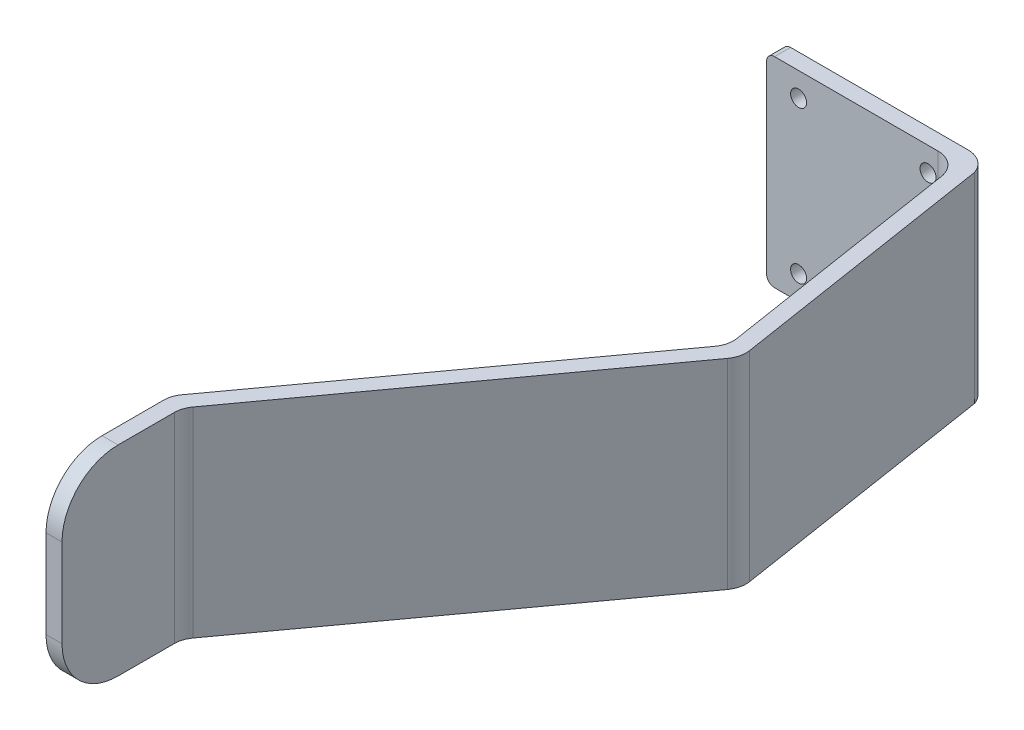
from build123d import *

# Parameters (mm, degrees)
SKETCH1_W           = 2
SKETCH1_H           = 15
SKETCH1_W_2         = 26
SKETCH1_H_2         = 2
BOSS_EXTRUDE1_DEPTH = 25
SKETCH2_R           = 2.5
BOSS_EXTRUDE2_DEPTH = 2
SKETCH3_R           = 2.5
BOSS_EXTRUDE3_DEPTH = 2
FILLET1_R           = 2.5
FILLET2_R           = 7
FILLET3_R           = 1
FILLET4_R           = 3
FILLET5_R           = 3
FILLET6_R           = 3
CUT_EXTRUDE2_REACH  = 99.071
SKETCH8_R           = 1


with BuildPart() as part:
    # Sketch1 → Boss-Extrude1 (new body)
    with BuildSketch(Plane(origin=(0, 0, 0), x_dir=(1, 0, 0), z_dir=(0, 1, 0))):
        Polygon((-12.616932988, -74.822915589), (-13, -75.349125674), (-13, -76), (-11, -76), (18.427110278, -35.576675289), (13, -1), (10.975513857, -1), (11.024189983, -1.310120587), (16.322926791, -35.068915352), align=None)
        with Locations((-12, -83.5)):
            Rectangle(SKETCH1_W, SKETCH1_H)
        Rectangle(SKETCH1_W_2, SKETCH1_H_2)
    extrude(amount=BOSS_EXTRUDE1_DEPTH)

    # Sketch2 → Boss-Extrude2 (add)
    with BuildSketch(Plane(origin=(10.558437112, 0, -1.657238647), x_dir=(0.15506029365043303, 0, 0.9879050082538512), z_dir=(-0.9879050082538512, 0, 0.15506029365043303))):
        with Locations((28.554289051, 18.75)):
            Circle(SKETCH2_R)
        with BuildLine():
            ThreePointArc((11.31127729, 16.25), (13.079044243, 16.982233047), (13.81127729, 18.75))
            Line((13.81127729, 18.75), (11.31127729, 18.75))
            Line((11.31127729, 18.75), (11.31127729, 16.25))
        make_face()
        with BuildLine():
            Line((11.31127729, 18.75), (13.81127729, 18.75))
            ThreePointArc((13.81127729, 18.75), (9.543510337, 20.517766953), (11.31127729, 16.25))
            Line((11.31127729, 16.25), (11.31127729, 18.75))
        make_face()
        with Locations((11.31127729, 6.25)):
            Circle(SKETCH2_R)
        with Locations((28.554289051, 6.25)):
            Circle(SKETCH2_R)
    extrude(amount=BOSS_EXTRUDE2_DEPTH)

    # Sketch3 → Boss-Extrude3 (add)
    with BuildSketch(Plane(origin=(27.355333892, 0, 19.913958906), x_dir=(-0.5885422055553007, 0, 0.8084664942223037), z_dir=(-0.8084664942223037, 0, -0.5885422055553007))):
        with BuildLine():
            ThreePointArc((33.701056824, 18.75), (29.433289871, 20.517766953), (31.201056824, 16.25))
            Line((31.201056824, 16.25), (31.201056824, 18.75))
            Line((31.201056824, 18.75), (33.701056824, 18.75))
        make_face()
        with BuildLine():
            Line((31.201056824, 18.75), (31.201056824, 16.25))
            ThreePointArc((31.201056824, 16.25), (32.968823777, 16.982233047), (33.701056824, 18.75))
            Line((33.701056824, 18.75), (31.201056824, 18.75))
        make_face()
        with Locations((31.201056824, 6.25)):
            Circle(SKETCH3_R)
        with Locations((56.11254704, 6.25)):
            Circle(SKETCH3_R)
        with Locations((56.11254704, 18.75)):
            Circle(SKETCH3_R)
    extrude(amount=BOSS_EXTRUDE3_DEPTH)

    # Fillet1
    # the kernel refuses this fillet: 2.5 mm, written as the material it takes off along each edge
    with BuildSketch(Plane(origin=(13.010263541, 18.75, 26.861807101), x_dir=(0.1550602936504321, 0, 0.9879050082538512), z_dir=(0, -1, 0))) as fillet1_piece_1:
        with BuildLine():
            CenterArc((0.050510257, -2.5), FILLET1_R, 11.536959033, 78.463040967)
            Line((0.050510257, 0), (0.050510257, 0.05))
            Line((0.050510257, 0.05), (2.5, 0.05))
            Line((2.5, 0.05), (2.55, 0))
            ThreePointArc((2.55, 0), (2.55, -1), (2.548989795, -1.99))
            Line((2.548989795, -1.99), (2.5, -2))
        make_face()
    revolve(axis=Axis((13.010263541, 18.75, 26.861807101), (-0.9879050082538512, 0, 0.15506029365043303)), mode=Mode.SUBTRACT)
    with BuildSketch(Plane(origin=(10.336557074, 18.75, 9.827349425), x_dir=(0, -1, 0), z_dir=(0.1550602936504327, 1.65855285874559e-14, 0.9879050082538511))) as fillet1_piece_2:
        with BuildLine():
            CenterArc((0.050510257, 2.5), FILLET1_R, 270, 78.463040967)
            Line((0.050510257, 0), (0.050510257, -0.05))
            Line((0.050510257, -0.05), (2.5, -0.05))
            Line((2.5, -0.05), (2.55, 0))
            ThreePointArc((2.55, 0), (2.55, 1), (2.548989795, 1.99))
            Line((2.548989795, 1.99), (2.5, 2))
        make_face()
    revolve(axis=Axis((10.336557074, 18.75, 9.827349425), (0.9879050082538511, 0, -0.1550602936504327)), mode=Mode.SUBTRACT)
    with BuildSketch(Plane(origin=(10.336557074, 6.25, 9.827349425), x_dir=(0.1550602936504327, 0, 0.9879050082538511), z_dir=(0, -1, 0))) as fillet1_piece_3:
        with BuildLine():
            CenterArc((0.050510257, -2.5), FILLET1_R, 11.536959033, 78.463040967)
            Line((0.050510257, 0), (0.050510257, 0.05))
            Line((0.050510257, 0.05), (2.5, 0.05))
            Line((2.5, 0.05), (2.55, 0))
            ThreePointArc((2.55, 0), (2.55, -1), (2.548989795, -1.99))
            Line((2.548989795, -1.99), (2.5, -2))
        make_face()
    revolve(axis=Axis((10.336557074, 6.25, 9.827349425), (-0.9879050082538512, 0, 0.15506029365043303)), mode=Mode.SUBTRACT)
    with BuildSketch(Plane(origin=(13.010263541, 6.25, 26.861807101), x_dir=(0.1550602936504321, 0, 0.9879050082538512), z_dir=(0, -1, 0))) as fillet1_piece_4:
        with BuildLine():
            CenterArc((0.050510257, -2.5), FILLET1_R, 11.536959033, 78.463040967)
            Line((0.050510257, 0), (0.050510257, 0.05))
            Line((0.050510257, 0.05), (2.5, 0.05))
            Line((2.5, 0.05), (2.55, 0))
            ThreePointArc((2.55, 0), (2.55, -1), (2.548989795, -1.99))
            Line((2.548989795, -1.99), (2.5, -2))
        make_face()
    revolve(axis=Axis((13.010263541, 6.25, 26.861807101), (-0.9879050082538512, 0, 0.15506029365043303)), mode=Mode.SUBTRACT)
    with BuildSketch(Plane(origin=(7.375262105, 18.75, 43.961883521), x_dir=(0, -1, 0), z_dir=(-0.5885422055553015, 1.776176572418508e-14, 0.8084664942223031))) as fillet1_piece_5:
        with BuildLine():
            CenterArc((0.050510257, 2.5), FILLET1_R, 270, 78.463040967)
            Line((0.050510257, 0), (0.050510257, -0.05))
            Line((0.050510257, -0.05), (2.5, -0.05))
            Line((2.5, -0.05), (2.55, 0))
            ThreePointArc((2.55, 0), (2.55, 1), (2.548989795, 1.99))
            Line((2.548989795, 1.99), (2.5, 2))
        make_face()
    revolve(axis=Axis((7.375262105, 18.75, 43.961883521), (0.8084664942223031, 0, 0.5885422055553015)), mode=Mode.SUBTRACT)
    with BuildSketch(Plane(origin=(7.375262105, 6.25, 43.961883521), x_dir=(-0.5885422055553018, 0, 0.8084664942223029), z_dir=(0, -1, 0))) as fillet1_piece_6:
        with BuildLine():
            CenterArc((0.050510257, -2.5), FILLET1_R, 11.536959033, 78.463040967)
            Line((0.050510257, 0), (0.050510257, 0.05))
            Line((0.050510257, 0.05), (2.5, 0.05))
            Line((2.5, 0.05), (2.55, 0))
            ThreePointArc((2.55, 0), (2.55, -1), (2.548989795, -1.99))
            Line((2.548989795, -1.99), (2.5, -2))
        make_face()
    revolve(axis=Axis((7.375262105, 6.25, 43.961883521), (-0.8084664942223037, 0, -0.5885422055553007)), mode=Mode.SUBTRACT)
    with BuildSketch(Plane(origin=(-7.286201291, 6.25, 64.101988682), x_dir=(-0.5885422055552982, 0, 0.8084664942223055), z_dir=(0, -1, 0))) as fillet1_piece_7:
        with BuildLine():
            CenterArc((0.050510257, -2.5), FILLET1_R, 11.536959033, 78.463040967)
            Line((0.050510257, 0), (0.050510257, 0.05))
            Line((0.050510257, 0.05), (2.5, 0.05))
            Line((2.5, 0.05), (2.55, 0))
            ThreePointArc((2.55, 0), (2.55, -1), (2.548989795, -1.99))
            Line((2.548989795, -1.99), (2.5, -2))
        make_face()
    revolve(axis=Axis((-7.286201291, 6.25, 64.101988682), (-0.8084664942223037, 0, -0.5885422055553007)), mode=Mode.SUBTRACT)
    with BuildSketch(Plane(origin=(-7.286201291, 18.75, 64.101988682), x_dir=(-0.5885422055552982, 0, 0.8084664942223055), z_dir=(0, -1, 0))) as fillet1_piece_8:
        with BuildLine():
            CenterArc((0.050510257, -2.5), FILLET1_R, 11.536959033, 78.463040967)
            Line((0.050510257, 0), (0.050510257, 0.05))
            Line((0.050510257, 0.05), (2.5, 0.05))
            Line((2.5, 0.05), (2.55, 0))
            ThreePointArc((2.55, 0), (2.55, -1), (2.548989795, -1.99))
            Line((2.548989795, -1.99), (2.5, -2))
        make_face()
    revolve(axis=Axis((-7.286201291, 18.75, 64.101988682), (-0.8084664942223037, 0, -0.5885422055553007)), mode=Mode.SUBTRACT)

    # Fillet2
    fillet2_edges = [part.edges().sort_by_distance(p)[0] for p in [
        (-12, 25, 91),
        (-12, 0, 91),
    ]]
    fillet(fillet2_edges, radius=FILLET2_R)

    # Fillet3
    fillet3_edges = [part.edges().sort_by_distance(p)[0] for p in [
        (-13, 0, 0),
        (-13, 25, 0),
    ]]
    fillet(fillet3_edges, radius=FILLET3_R)

    # Fillet4
    # the kernel refuses this fillet: 3 mm, written as the material it adds along each edge
    with BuildSketch(Plane(origin=(10.975513857, 0, 1), x_dir=(-1, 0, 0), z_dir=(0, 1, 0))) as fillet4_piece_1:
        with BuildLine():
            CenterArc((FILLET4_R * 0.855284363669, FILLET4_R), FILLET4_R, 188.920293103, 81.079706897)
            Line((-FILLET4_R * 0.132620644585, FILLET4_R * 0.84493970635), (0, 0))
            Line((0, 0), (FILLET4_R * 0.855284363669, 0))
        make_face()
    extrude(amount=25)
    # the kernel refuses this fillet: 3 mm, written as the material it takes off along each edge
    with BuildSketch(Plane(origin=(13, -7.071067812, -1), x_dir=(-1, 0, 0), z_dir=(0, 1, 0))) as fillet4_2_piece_1:
        with BuildLine():
            CenterArc((2.828427125, 3), FILLET4_R, 199.471220634, 70.528779366)
            Line((0, 2), (0, 0))
            Line((0, 0), (2.828427125, 0))
        make_face()
    extrude(amount=39.142135624, mode=Mode.SUBTRACT)

    # Fillet5
    fillet5_edges = [part.edges().sort_by_distance(p)[0] for p in [
        (16.322926791, 12.5, 35.068915352),
        (18.427110278, 12.5, 35.576675289),
    ]]
    fillet(fillet5_edges, radius=FILLET5_R)

    # Fillet6
    fillet6_edges = [part.edges().sort_by_distance(p)[0] for p in [
        (-11, 12.5, 76),
        (-13, 12.5, 75.349125674),
    ]]
    fillet(fillet6_edges, radius=FILLET6_R)

    # Sketch8 → Cut-Extrude2 (cut, up to next)
    with BuildSketch(Plane(origin=(0, 0, -1), x_dir=(-1, 0, 0), z_dir=(0, 0, -1)), mode=Mode.PRIVATE) as cut_extrude2_sk1:
        with Locations((-7.171572875, 3)):
            Circle(SKETCH8_R)
    cut_extrude2_tool1 = extrude(cut_extrude2_sk1.sketch, amount=-CUT_EXTRUDE2_REACH, mode=Mode.PRIVATE) & part.part
    # Sketch8 → Cut-Extrude2 (cut, up to next)
    with BuildSketch(Plane(origin=(0, 0, -1), x_dir=(-1, 0, 0), z_dir=(0, 0, -1)), mode=Mode.PRIVATE) as cut_extrude2_sk2:
        with BuildLine():
            ThreePointArc((-7.171572875, 23), (-7.878679656, 22.707106781), (-8.171572875, 22))
            Line((-8.171572875, 22), (-7.171572875, 22))
            Line((-7.171572875, 22), (-7.171572875, 23))
        make_face()
    cut_extrude2_tool2 = extrude(cut_extrude2_sk2.sketch, amount=-CUT_EXTRUDE2_REACH, mode=Mode.PRIVATE) & part.part
    # Sketch8 → Cut-Extrude2 (cut, up to next)
    with BuildSketch(Plane(origin=(0, 0, -1), x_dir=(-1, 0, 0), z_dir=(0, 0, -1)), mode=Mode.PRIVATE) as cut_extrude2_sk3:
        with BuildLine():
            Line((-7.171572875, 22), (-8.171572875, 22))
            ThreePointArc((-8.171572875, 22), (-7.171572875, 21), (-6.171572875, 22))
            ThreePointArc((-6.171572875, 22), (-6.464466094, 22.707106781), (-7.171572875, 23))
            Line((-7.171572875, 23), (-7.171572875, 22))
        make_face()
    cut_extrude2_tool3 = extrude(cut_extrude2_sk3.sketch, amount=-CUT_EXTRUDE2_REACH, mode=Mode.PRIVATE) & part.part
    # Sketch8 → Cut-Extrude2 (cut, up to next)
    with BuildSketch(Plane(origin=(0, 0, -1), x_dir=(-1, 0, 0), z_dir=(0, 0, -1)), mode=Mode.PRIVATE) as cut_extrude2_sk4:
        with BuildLine():
            ThreePointArc((-7.171572875, 23), (-7.878679656, 22.707106781), (-8.171572875, 22))
            Line((-8.171572875, 22), (-7.171572875, 22))
            Line((-7.171572875, 22), (-7.171572875, 23))
        make_face()
    cut_extrude2_tool4 = extrude(cut_extrude2_sk4.sketch, amount=-CUT_EXTRUDE2_REACH, mode=Mode.PRIVATE) & part.part
    # Sketch8 → Cut-Extrude2 (cut, up to next)
    with BuildSketch(Plane(origin=(0, 0, -1), x_dir=(-1, 0, 0), z_dir=(0, 0, -1)), mode=Mode.PRIVATE) as cut_extrude2_sk5:
        with BuildLine():
            Line((-7.171572875, 22), (-8.171572875, 22))
            ThreePointArc((-8.171572875, 22), (-7.171572875, 21), (-6.171572875, 22))
            ThreePointArc((-6.171572875, 22), (-6.464466094, 22.707106781), (-7.171572875, 23))
            Line((-7.171572875, 23), (-7.171572875, 22))
        make_face()
    cut_extrude2_tool5 = extrude(cut_extrude2_sk5.sketch, amount=-CUT_EXTRUDE2_REACH, mode=Mode.PRIVATE) & part.part
    # Sketch8 → Cut-Extrude2 (cut, up to next)
    with BuildSketch(Plane(origin=(0, 0, -1), x_dir=(-1, 0, 0), z_dir=(0, 0, -1)), mode=Mode.PRIVATE) as cut_extrude2_sk6:
        with Locations((9, 22)):
            Circle(SKETCH8_R)
    cut_extrude2_tool6 = extrude(cut_extrude2_sk6.sketch, amount=-CUT_EXTRUDE2_REACH, mode=Mode.PRIVATE) & part.part
    # Sketch8 → Cut-Extrude2 (cut, up to next)
    with BuildSketch(Plane(origin=(0, 0, -1), x_dir=(-1, 0, 0), z_dir=(0, 0, -1)), mode=Mode.PRIVATE) as cut_extrude2_sk7:
        with Locations((9, 3)):
            Circle(SKETCH8_R)
    cut_extrude2_tool7 = extrude(cut_extrude2_sk7.sketch, amount=-CUT_EXTRUDE2_REACH, mode=Mode.PRIVATE) & part.part
    add(cut_extrude2_tool1.solids().sort_by_distance((7.171573, 3, -1))[0], mode=Mode.SUBTRACT)
    add(cut_extrude2_tool2.solids().sort_by_distance((7.595986, 22.424413, -1))[0], mode=Mode.SUBTRACT)
    add(cut_extrude2_tool3.solids().sort_by_distance((7.030102, 21.858529, -1))[0], mode=Mode.SUBTRACT)
    add(cut_extrude2_tool4.solids().sort_by_distance((7.595986, 22.424413, -1))[0], mode=Mode.SUBTRACT)
    add(cut_extrude2_tool5.solids().sort_by_distance((7.030102, 21.858529, -1))[0], mode=Mode.SUBTRACT)
    add(cut_extrude2_tool6.solids().sort_by_distance((-9, 22, -1))[0], mode=Mode.SUBTRACT)
    add(cut_extrude2_tool7.solids().sort_by_distance((-9, 3, -1))[0], mode=Mode.SUBTRACT)


solid = part.part
